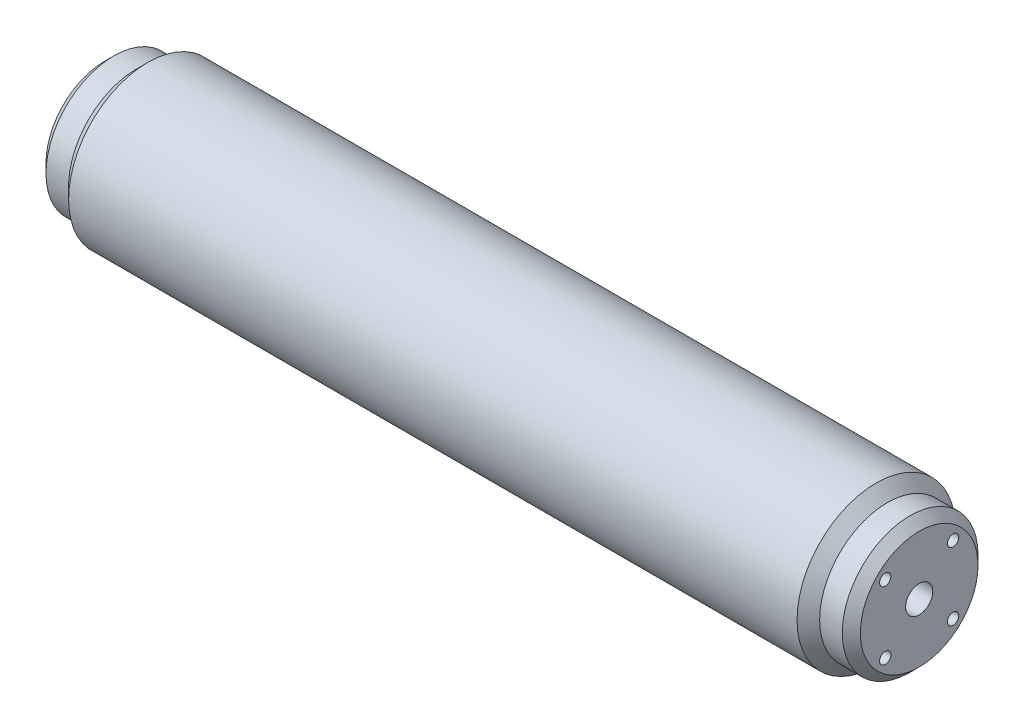
from build123d import *

# Parameters (mm, degrees)
SKETCH1_R                  = 17.5
BOSS_EXTRUDE1_DEPTH        = 80
SKETCH7_R                  = 15
BOSS_EXTRUDE2_DEPTH        = 10
CHAMFER1_SIZE              = 3
CHAMFER2_SIZE              = 2
M3_TAPPED_HOLE1_AT_2_COUNT = 2
M3_TAPPED_HOLE1_AT_2_PITCH = 15
M3_TAPPED_HOLE1_AT_3_COUNT = 2
M3_TAPPED_HOLE1_AT_3_PITCH = 21.213203436
M3_TAPPED_HOLE1_AT_4_COUNT = 2
M3_TAPPED_HOLE1_AT_4_PITCH = 15


with BuildPart() as part:
    # Sketch1 → Boss-Extrude1 (new, symmetric)
    with BuildSketch(Plane(origin=(0, 0, 0), x_dir=(0, 0, -1), z_dir=(1, 0, 0))):
        Circle(SKETCH1_R)
    extrude(amount=BOSS_EXTRUDE1_DEPTH, both=True)

    # Sketch7 → Boss-Extrude2 (add)
    with BuildSketch(Plane.ZY.offset(80)):
        Circle(SKETCH7_R)
    boss_extrude2 = extrude(amount=BOSS_EXTRUDE2_DEPTH)

    # Mirror3: Boss-Extrude2 across plane
    add(boss_extrude2.mirror(Plane(origin=(0, 0, 0), x_dir=(0, 0, 1), z_dir=(1, 0, 0))))

    # Chamfer1
    # the kernel refuses this chamfer: 3 mm, written as the material it adds along each edge
    with BuildSketch(Plane(origin=(80, 0, 0), x_dir=(0, 0, 1), z_dir=(0, -1, 0))) as chamfer1_piece_1_section:
        Polygon((15 + CHAMFER1_SIZE, 0), (15, -CHAMFER1_SIZE), (15, 0), align=None)
    chamfer1_piece_1 = revolve(axis=Axis((80, 0, 0), (-1, 0, 0)), mode=Mode.PRIVATE)
    chamfer1_piece_1 = chamfer1_piece_1 & Plane(origin=(81.737216011, 0, 0), x_dir=(0, 0, -1), z_dir=(1, 0, 0)) * Cylinder(17.5, 72, mode=Mode.PRIVATE)
    add(chamfer1_piece_1)
    with BuildSketch(Plane(origin=(-80, 0, 0), x_dir=(0, 0, 1), z_dir=(0, -1, 0))) as chamfer1_piece_2_section:
        Polygon((15 + CHAMFER1_SIZE, 0), (15, CHAMFER1_SIZE), (15, 0), align=None)
    chamfer1_piece_2 = revolve(axis=Axis((-80, 0, 0), (-1, 0, 0)), mode=Mode.PRIVATE)
    chamfer1_piece_2 = chamfer1_piece_2 & Plane(origin=(-81.737216011, 0, 0), x_dir=(0, 0, -1), z_dir=(1, 0, 0)) * Cylinder(17.5, 72, mode=Mode.PRIVATE)
    add(chamfer1_piece_2)

    # Chamfer2
    chamfer2_edges = [part.edges().sort_by_distance(p)[0] for p in [
        (90, 0, -15),
        (-90, 0, -15),
    ]]
    chamfer(chamfer2_edges, length=CHAMFER2_SIZE)

    # Sketch9 → M3 Tapped Hole1 (revolve, cut)
    with BuildSketch(Plane(origin=(-90, 7.5, -7.5), x_dir=(0, 0, 1), z_dir=(0, 1, 0))):
        Polygon((0, 0), (0, 9.251075774), (1.25, 8.5), (1.25, 0), align=None)
    m3_tapped_hole1 = revolve(axis=Axis((-96.35, 7.5, -7.5), (1, 0, 0)), mode=Mode.SUBTRACT)

    # M3 Tapped Hole1 at 2: M3 Tapped Hole1 ×2
    with Locations(*[(0, 0, i * M3_TAPPED_HOLE1_AT_2_PITCH) for i in range(1, M3_TAPPED_HOLE1_AT_2_COUNT)]):
        add(m3_tapped_hole1, mode=Mode.SUBTRACT)

    # M3 Tapped Hole1 at 3: M3 Tapped Hole1 ×2
    with Locations(*[Vector(0, -0.7071067811865476, 0.7071067811865475) * (i * M3_TAPPED_HOLE1_AT_3_PITCH) for i in range(1, M3_TAPPED_HOLE1_AT_3_COUNT)]):
        add(m3_tapped_hole1, mode=Mode.SUBTRACT)

    # M3 Tapped Hole1 at 4: M3 Tapped Hole1 ×2
    with Locations(*[(0, -i * M3_TAPPED_HOLE1_AT_4_PITCH, 0) for i in range(1, M3_TAPPED_HOLE1_AT_4_COUNT)]):
        add(m3_tapped_hole1, mode=Mode.SUBTRACT)

    # Sketch11 → Ø6.0mm Dowel Hole1 (revolve, cut)
    with BuildSketch(Plane(origin=(-90, 0, 0), x_dir=(0, 0, 1), z_dir=(0, 1, 0))):
        Polygon((0, 0), (0, 10.302581857), (3, 8.5), (3, 0), align=None)
    f_6_0mm_dowel_hole1 = revolve(axis=Axis((-96.35, 0, 0), (1, 0, 0)), mode=Mode.SUBTRACT)

    # Mirror4: M3 Tapped Hole1, Ø6.0mm Dowel Hole1 across plane
    add(m3_tapped_hole1.mirror(Plane(origin=(0, 0, 0), x_dir=(0, 0, 1), z_dir=(1, 0, 0))), mode=Mode.SUBTRACT)
    add(f_6_0mm_dowel_hole1.mirror(Plane(origin=(0, 0, 0), x_dir=(0, 0, 1), z_dir=(1, 0, 0))), mode=Mode.SUBTRACT)

    # Mirror4 copy 1 sketch → Mirror4 copy 1 (revolve, cut)
    with BuildSketch(Plane(origin=(90, 7.5, 7.5), x_dir=(0, 0, 1), z_dir=(0, 1, 0))):
        Polygon((0, 0), (0, -9.251075774), (1.25, -8.5), (1.25, 0), align=None)
    revolve(axis=Axis((96.35, 7.5, 7.5), (1, 0, 0)), mode=Mode.SUBTRACT)

    # Mirror4 copy 2 sketch → Mirror4 copy 2 (revolve, cut)
    with BuildSketch(Plane(origin=(90, -7.5, 7.5), x_dir=(0, 0, 1), z_dir=(0, 1, 0))):
        Polygon((0, 0), (0, -9.251075774), (1.25, -8.5), (1.25, 0), align=None)
    revolve(axis=Axis((96.35, -7.5, 7.5), (1, 0, 0)), mode=Mode.SUBTRACT)

    # Mirror4 copy 3 sketch → Mirror4 copy 3 (revolve, cut)
    with BuildSketch(Plane(origin=(90, -7.5, -7.5), x_dir=(0, 0, 1), z_dir=(0, 1, 0))):
        Polygon((0, 0), (0, -9.251075774), (1.25, -8.5), (1.25, 0), align=None)
    revolve(axis=Axis((96.35, -7.5, -7.5), (1, 0, 0)), mode=Mode.SUBTRACT)


solid = part.part
